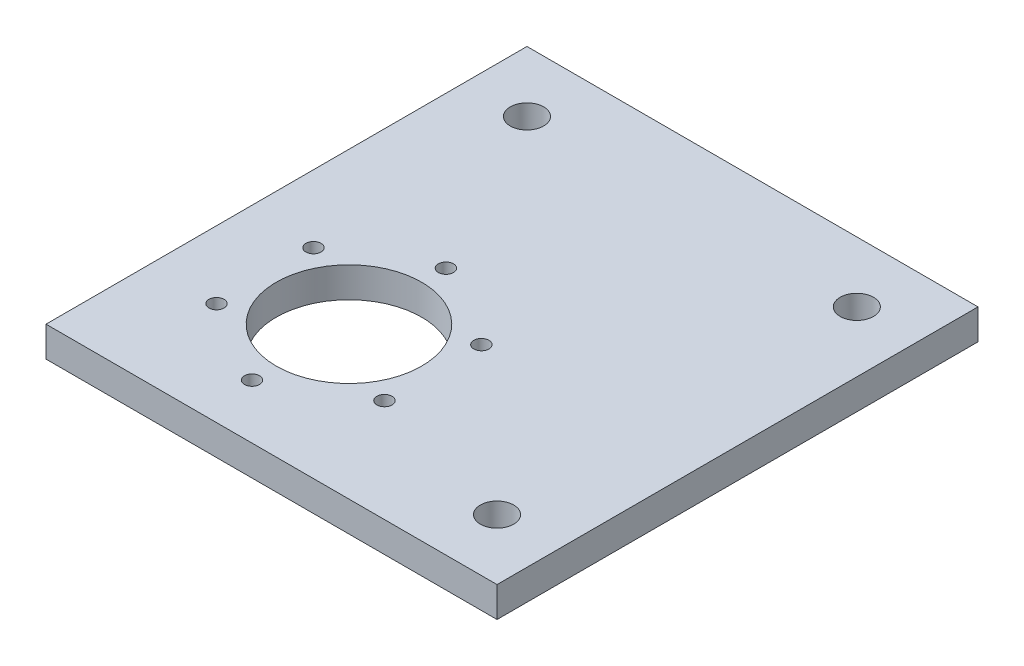
from build123d import *

# Parameters (mm, degrees)
SKETCH2_W           = 74.44
SKETCH2_H           = 79.38
SKETCH2_R           = 12
BOSS_EXTRUDE1_DEPTH = 5
SKETCH5_R           = 1.25
CUT_EXTRUDE1_DEPTH  = 6
SKETCH6_R           = 2.75
CUT_EXTRUDE2_DEPTH  = 10


with BuildPart() as part:
    # Sketch2 → Boss-Extrude1 (new body)
    with BuildSketch(Plane(origin=(0, 0, 0), x_dir=(1, 0, 0), z_dir=(0, 1, 0))):
        with Locations((18.526729133, 13.835644594)):
            Rectangle(SKETCH2_W, SKETCH2_H)
        with Locations((6.306729133, -0.854355406)):
            Circle(SKETCH2_R, mode=Mode.SUBTRACT)
    extrude(amount=BOSS_EXTRUDE1_DEPTH)

    # Sketch5 → Cut-Extrude1 (cut)
    with BuildSketch(Plane(origin=(0, 5, 0), x_dir=(1, 0, 0), z_dir=(0, 1, 0))):
        with Locations((6.306729133, 15.145644594)):
            Circle(SKETCH5_R)
        with Locations((20.163135594, 7.145644594)):
            Circle(SKETCH5_R)
        with Locations((20.163135594, -8.854355406)):
            Circle(SKETCH5_R)
        with Locations((6.306729133, -16.854355406)):
            Circle(SKETCH5_R)
        with Locations((-7.549677327, -8.854355406)):
            Circle(SKETCH5_R)
        with Locations((-7.549677327, 7.145644594)):
            Circle(SKETCH5_R)
    extrude(amount=-CUT_EXTRUDE1_DEPTH, mode=Mode.SUBTRACT)

    # Sketch6 → Cut-Extrude2 (cut)
    with BuildSketch(Plane.XZ):
        with Locations((45.746729133, 15.854355406)):
            Circle(SKETCH6_R)
        with Locations((45.746729133, -43.525644594)):
            Circle(SKETCH6_R)
        with Locations((-8.693270867, -43.525644594)):
            Circle(SKETCH6_R)
    extrude(amount=-CUT_EXTRUDE2_DEPTH, mode=Mode.SUBTRACT)


solid = part.part
